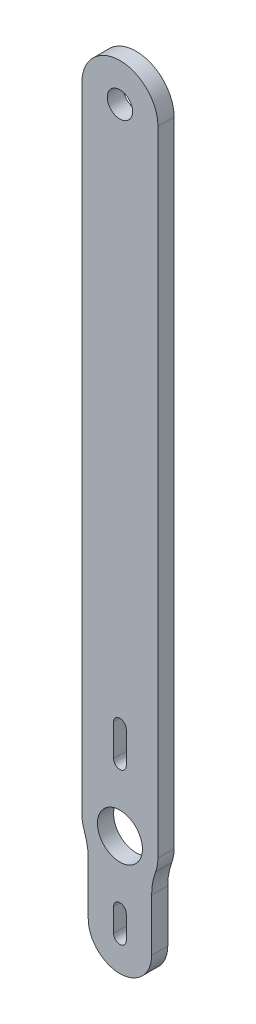
from build123d import *

# Parameters (mm, degrees)
MODEL_R             = 3.55
MODEL_R_2           = 2
BOSS_EXTRUDE1_DEPTH = 2.55


with BuildPart() as part:
    # Model → Boss-Extrude1 (new body)
    with BuildSketch(Plane.XY):
        with BuildLine():
            Line((-6, 0), (-6, 100))
            ThreePointArc((-6, 100), (0, 106), (6, 100))
            Line((6, 100), (6, 0))
            ThreePointArc((6, 0), (5.905505906, -1.060660172), (5.625, -2.087911636))
            ThreePointArc((5.625, -2.087911636), (5.157490157, -3.79999741), (5, -5.567764363))
            Line((5, -5.567764363), (5, -13.8))
            ThreePointArc((5, -13.8), (0, -18.8), (-5, -13.8))
            Line((-5, -13.8), (-5, -5.567764363))
            ThreePointArc((-5, -5.567764363), (-5.157490157, -3.79999741), (-5.625, -2.087911636))
            ThreePointArc((-5.625, -2.087911636), (-5.905505906, -1.060660172), (-6, 0))
        make_face()
        Circle(MODEL_R, mode=Mode.SUBTRACT)
        with Locations((0, 100)):
            Circle(MODEL_R_2, mode=Mode.SUBTRACT)
        with BuildLine():
            Line((-1, -10.1), (-1, -13.8))
            ThreePointArc((-1, -13.8), (0, -14.8), (1, -13.8))
            Line((1, -13.8), (1, -10.1))
            ThreePointArc((1, -10.1), (0, -9.1), (-1, -10.1))
        make_face(mode=Mode.SUBTRACT)
        with BuildLine():
            Line((-1, 15.1), (-1, 10.1))
            ThreePointArc((-1, 10.1), (0, 9.1), (1, 10.1))
            Line((1, 10.1), (1, 15.1))
            ThreePointArc((1, 15.1), (0, 16.1), (-1, 15.1))
        make_face(mode=Mode.SUBTRACT)
    extrude(amount=BOSS_EXTRUDE1_DEPTH)


solid = part.part
